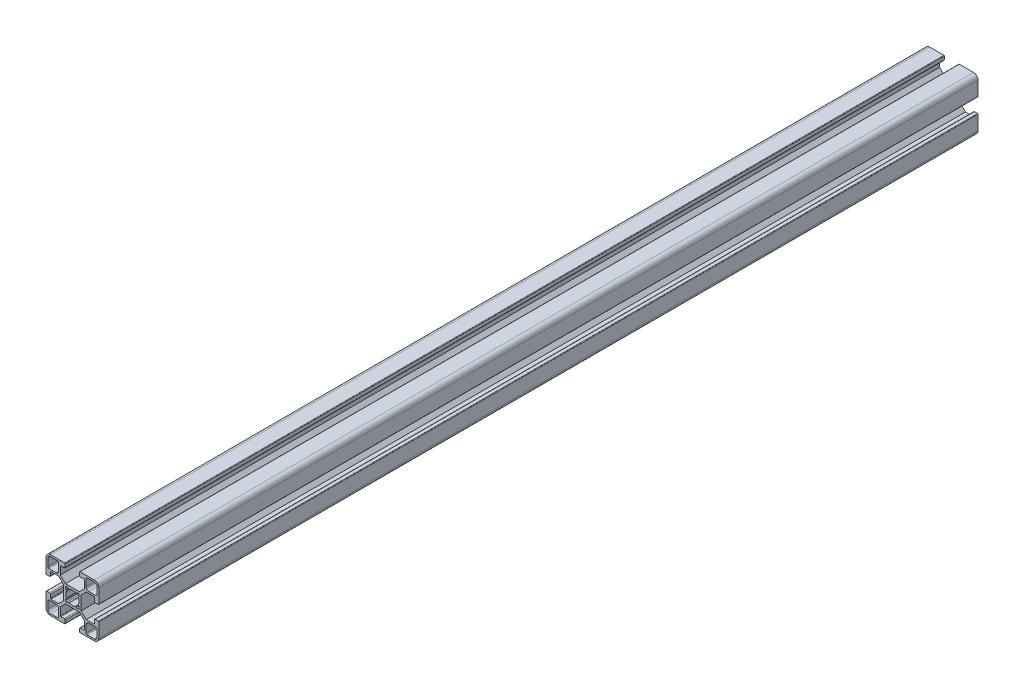
from build123d import *

# Parameters (mm, degrees)
BOSS_EXTRUDE1_DEPTH = 250


with BuildPart() as part:
    # Sketch1 → Boss-Extrude1 (new, symmetric)
    with BuildSketch(Plane.XY):
        with BuildLine():
            Line((21.799990977, 7.139350412), (18.939335294, 10.000004729))
            Line((18.939335294, 10.000004729), (11.060654294, 10.000000095))
            Line((11.060654294, 10.000000095), (8.200000977, 7.139342412))
            Line((8.200000977, 7.139342412), (8.200003529, 2.800001412))
            ThreePointArc((8.200003529, 2.800001412), (8.28786862, 2.587867672), (8.500000706, 2.499998588))
            Line((8.500000706, 2.499998588), (10.400000706, 2.499999706))
            ThreePointArc((10.400000706, 2.499999706), (10.753554287, 2.353553201), (10.900001, 1.999999706))
            Line((10.900001, 1.999999706), (10.900001, 0.299996823))
            ThreePointArc((10.900001, 0.299996823), (10.812134558, 0.087867732), (10.600006, 0))
            Line((10.600006, 0), (2.5, 0))
            ThreePointArc((2.5, 0), (0.732233047, 0.732233047), (0, 2.5))
            Line((0, 2.5), (0, 10.600006))
            ThreePointArc((0, 10.600006), (0.087869562, 10.812137388), (0.300003, 10.900002))
            Line((0.300003, 10.900002), (2, 10.900002))
            ThreePointArc((2, 10.900002), (2.353553391, 10.753555391), (2.5, 10.400002))
            Line((2.5, 10.400002), (2.5, 8.500002))
            ThreePointArc((2.5, 8.500002), (2.587869099, 8.287870075), (2.80000269, 8.200005))
            Line((2.80000269, 8.200005), (7.139344, 8.200005))
            Line((7.139344, 8.200005), (10, 11.06066))
            Line((10, 11.06066), (10, 18.939341))
            Line((10, 18.939341), (7.139344, 21.799995))
            Line((7.139344, 21.799995), (2.800003, 21.799995))
            ThreePointArc((2.800003, 21.799995), (2.587869208, 21.712130034), (2.5, 21.499998))
            Line((2.5, 21.499998), (2.5, 19.59999775))
            ThreePointArc((2.5, 19.59999775), (2.353553161, 19.246444027), (1.999999309, 19.0999975))
            Line((1.999999309, 19.0999975), (0.299996735, 19.099999))
            ThreePointArc((0.299996735, 19.099999), (0.087867778, 19.187865661), (2.65e-07, 19.399994265))
            Line((2.65e-07, 19.399994265), (2.65e-07, 27.500000265))
            ThreePointArc((2.65e-07, 27.500000265), (0.732233312, 29.267767218), (2.500000265, 30.000000265))
            Line((2.500000265, 30.000000265), (10.6000062, 30.000000265))
            ThreePointArc((10.6000062, 30.000000265), (10.812136906, 29.912130185), (10.900001, 29.699997))
            Line((10.900001, 29.699997), (10.900001, 28))
            ThreePointArc((10.900001, 28), (10.75355439, 27.646446609), (10.400001, 27.5))
            Line((10.400001, 27.5), (8.499999, 27.5))
            ThreePointArc((8.499999, 27.5), (8.287868368, 27.412130194), (8.200004, 27.19999731))
            Line((8.200004, 27.19999731), (8.200004, 22.860655))
            Line((8.200004, 22.860655), (11.060659, 20))
            Line((11.060659, 20), (18.93934, 20))
            Line((18.93934, 20), (21.799994, 22.860655))
            Line((21.799994, 22.860655), (21.799994, 27.199997))
            ThreePointArc((21.799994, 27.199997), (21.712129034, 27.412130792), (21.499997, 27.5))
            Line((21.499997, 27.5), (19.599981706, 27.5))
            ThreePointArc((19.599981706, 27.5), (19.246428419, 27.646446505), (19.099981706, 27.999999706))
            Line((19.099981706, 27.999999706), (19.099980706, 29.700007823))
            ThreePointArc((19.099980706, 29.700007823), (19.187847107, 29.912137435), (19.399976029, 30.0000055))
            Line((19.399976029, 30.0000055), (27.499982029, 30.0000055))
            ThreePointArc((27.499982029, 30.0000055), (29.267764732, 29.267777107), (30.0000055, 27.499999529))
            Line((30.0000055, 27.499999529), (30.0000055, 19.399993594))
            ThreePointArc((30.0000055, 19.399993594), (29.912142492, 19.187844223), (29.6999965, 19.099973058))
            Line((29.6999965, 19.099973058), (27.9999995, 19.099974558))
            ThreePointArc((27.9999995, 19.099974558), (27.646437821, 19.246429455), (27.4999995, 19.599998))
            Line((27.4999995, 19.599998), (27.4999995, 21.5))
            ThreePointArc((27.4999995, 21.5), (27.412129694, 21.712130632), (27.19999681, 21.799995))
            Line((27.19999681, 21.799995), (22.8606545, 21.799995))
            Line((22.8606545, 21.799995), (19.9999995, 18.939341))
            Line((19.9999995, 18.939341), (19.9999995, 11.06066))
            Line((19.9999995, 11.06066), (22.8606545, 8.200005))
            Line((22.8606545, 8.200005), (27.1999965, 8.200005))
            ThreePointArc((27.1999965, 8.200005), (27.412129603, 8.287869277), (27.4999995, 8.500000051))
            Line((27.4999995, 8.500000051), (27.4999995, 10.400002))
            ThreePointArc((27.4999995, 10.400002), (27.646446109, 10.753555391), (27.9999995, 10.900002))
            Line((27.9999995, 10.900002), (29.7000025, 10.900002))
            ThreePointArc((29.7000025, 10.900002), (29.912129264, 10.812133269), (29.999995, 10.600005265))
            Line((29.999995, 10.600005265), (29.999995, 2.499999265))
            ThreePointArc((29.999995, 2.499999265), (29.26776322, 0.732236385), (27.500000177, 5e-06))
            Line((27.500000177, 5e-06), (19.399994245, 5e-06))
            ThreePointArc((19.399994245, 5e-06), (19.187862761, 0.087874413), (19.099998, 0.300007824))
            Line((19.099998, 0.300007824), (19.099997, 2.000004824))
            ThreePointArc((19.099997, 2.000004824), (19.246443401, 2.3535583), (19.599996706, 2.500005118))
            Line((19.599996706, 2.500005118), (21.499998706, 2.500006235))
            ThreePointArc((21.499998706, 2.500006235), (21.712129286, 2.587876166), (21.799993529, 2.800009102))
            Line((21.799993529, 2.800009102), (21.799990977, 7.139350412))
        make_face()
        with BuildLine():
            Line((18.878868942, 11.714100014), (18.657285002, 12.75690673))
            Line((18.657285002, 12.75690673), (18.419345869, 12.994846743))
            ThreePointArc((18.419345869, 12.994846743), (18.335473622, 13.158180995), (18.362480424, 13.339793948))
            ThreePointArc((18.362480424, 13.339793948), (18.750006156, 14.99998656), (18.362487962, 16.660180933))
            ThreePointArc((18.362487962, 16.660180933), (18.335481889, 16.841794157), (18.419354758, 17.005128271))
            Line((18.419354758, 17.005128271), (18.657294593, 17.243067582))
            Line((18.657294593, 17.243067582), (18.878893628, 18.28587109))
            ThreePointArc((18.878893628, 18.28587109), (18.743367928, 18.743355263), (18.285883756, 18.878880962))
            Line((18.285883756, 18.878880962), (17.243080247, 18.657281928))
            Line((17.243080247, 18.657281928), (17.005140412, 18.419342617))
            ThreePointArc((17.005140412, 18.419342617), (16.84180664, 18.335470316), (16.660194009, 18.362476539))
            ThreePointArc((16.660194009, 18.362476539), (15.00000526, 18.749996344), (13.339816433, 18.362476869))
            ThreePointArc((13.339816433, 18.362476869), (13.158203164, 18.335470716), (12.994869031, 18.419343671))
            Line((12.994869031, 18.419343671), (12.756929898, 18.657283684))
            Line((12.756929898, 18.657283684), (11.714126233, 18.878881984))
            ThreePointArc((11.714126233, 18.878881984), (11.256641967, 18.743355772), (11.121116891, 18.28587117))
            Line((11.121116891, 18.28587117), (11.342717777, 17.243068055))
            Line((11.342717777, 17.243068055), (11.580656587, 17.00512772))
            ThreePointArc((11.580656587, 17.00512772), (11.664528478, 16.841794182), (11.637522309, 16.660181943))
            ThreePointArc((11.637522309, 16.660181943), (11.250003617, 14.999998075), (11.637519652, 13.339813587))
            ThreePointArc((11.637519652, 13.339813587), (11.664525497, 13.15820068), (11.580652734, 12.994866901))
            Line((11.580652734, 12.994866901), (11.342712898, 12.75692759))
            Line((11.342712898, 12.75692759), (11.12111194, 11.71412449))
            ThreePointArc((11.12111194, 11.71412449), (11.256636795, 11.256640068), (11.714120718, 11.121113524))
            Line((11.714120718, 11.121113524), (12.756924635, 11.342710635))
            Line((12.756924635, 11.342710635), (12.99486447, 11.580649946))
            ThreePointArc((12.99486447, 11.580649946), (13.158198441, 11.66452228), (13.339811235, 11.637515845))
            ThreePointArc((13.339811235, 11.637515845), (14.999988879, 11.249993804), (16.660169832, 11.637501672))
            ThreePointArc((16.660169832, 11.637501672), (16.841782614, 11.664506717), (17.005115943, 11.580633605))
            Line((17.005115943, 11.580633605), (17.243054753, 11.34269327))
            Line((17.243054753, 11.34269327), (18.285858839, 11.12109695))
            ThreePointArc((18.285858839, 11.12109695), (18.743339639, 11.256620822), (18.878868942, 11.714100014))
        make_face(mode=Mode.SUBTRACT)
        with BuildLine():
            Line((23.299995, 1), (27.5, 1))
            ThreePointArc((27.5, 1), (28.560660172, 1.439339828), (29, 2.5))
            Line((29, 2.5), (29, 6.700005))
            ThreePointArc((29, 6.700005), (28.853553391, 7.053558391), (28.5, 7.200005))
            Line((28.5, 7.200005), (24.299995, 7.200005))
            ThreePointArc((24.299995, 7.200005), (23.239334828, 6.760665172), (22.799995, 5.700005))
            Line((22.799995, 5.700005), (22.799995, 1.5))
            ThreePointArc((22.799995, 1.5), (22.946441609, 1.146446609), (23.299995, 1))
        make_face(mode=Mode.SUBTRACT)
        with BuildLine():
            Line((2.5, 1), (6.700005, 1))
            ThreePointArc((6.700005, 1), (7.05355839, 1.146446609), (7.200005, 1.5))
            Line((7.200005, 1.5), (7.200005, 5.700005))
            ThreePointArc((7.200005, 5.700005), (6.760665172, 6.760665172), (5.700005, 7.200005))
            Line((5.700005, 7.200005), (1.5, 7.200005))
            ThreePointArc((1.5, 7.200005), (1.146446609, 7.053558391), (1, 6.700005))
            Line((1, 6.700005), (1, 2.5))
            ThreePointArc((1, 2.5), (1.439339828, 1.439339828), (2.5, 1))
        make_face(mode=Mode.SUBTRACT)
        with BuildLine():
            Line((1.500000265, 22.799995265), (5.700005, 22.799995265))
            ThreePointArc((5.700005, 22.799995265), (6.760665172, 23.239335093), (7.200005, 24.299995265))
            Line((7.200005, 24.299995265), (7.200005, 28.500000265))
            ThreePointArc((7.200005, 28.500000265), (7.053558484, 28.853553562), (6.700005265, 29.000000265))
            Line((6.700005265, 29.000000265), (2.500000265, 29.000000265))
            ThreePointArc((2.500000265, 29.000000265), (1.439340093, 28.560660437), (1.000000265, 27.500000265))
            Line((1.000000265, 27.500000265), (1.000000265, 23.299995265))
            ThreePointArc((1.000000265, 23.299995265), (1.146446874, 22.946441874), (1.500000265, 22.799995265))
        make_face(mode=Mode.SUBTRACT)
        with BuildLine():
            Line((24.299995265, 22.799995265), (28.500000265, 22.799995265))
            ThreePointArc((28.500000265, 22.799995265), (28.853553655, 22.946441874), (29.000000265, 23.299995265))
            Line((29.000000265, 23.299995265), (29.000000265, 27.500000265))
            ThreePointArc((29.000000265, 27.500000265), (28.560660437, 28.560660437), (27.500000265, 29.000000265))
            Line((27.500000265, 29.000000265), (23.299995265, 29.000000265))
            ThreePointArc((23.299995265, 29.000000265), (22.946441874, 28.853553655), (22.799995265, 28.500000265))
            Line((22.799995265, 28.500000265), (22.799995265, 24.299995265))
            ThreePointArc((22.799995265, 24.299995265), (23.239335093, 23.239335093), (24.299995265, 22.799995265))
        make_face(mode=Mode.SUBTRACT)
    extrude(amount=BOSS_EXTRUDE1_DEPTH, both=True)


solid = part.part
